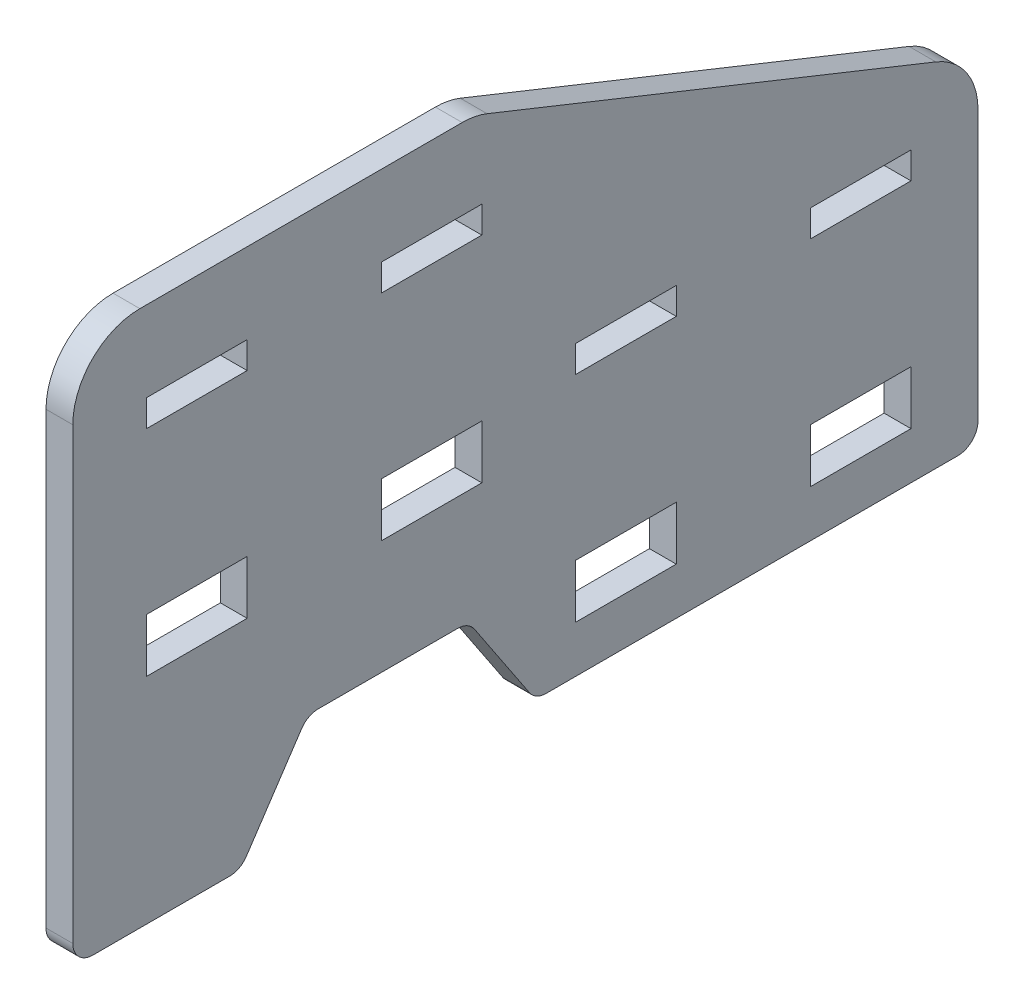
from build123d import *

# Parameters (mm, degrees)
GRUNDFORM_DEPTH          = 4
SKIZZE2_W                = 15
SKIZZE2_H                = 4
ZAPFENDURCHBRUCH_DEPTH   = 157.974520225
VERRUNDUNG1_R            = 10
VERRUNDUNG2_R            = 3
SKIZZE3_W                = 15
SKIZZE3_H                = 4
ZAPFENDURCHBRUCH_2_DEPTH = 4


with BuildPart() as part:
    # Skizze1 → Grundform (new body)
    with BuildSketch(Plane(origin=(0, 0, 0), x_dir=(0, 0, -1), z_dir=(1, 0, 0))):
        Polygon((0, 0), (25, 0), (35, 15), (59, 15), (69, 0), (135, 0), (135, 50), (60, 80), (0, 80), align=None)
    extrude(amount=GRUNDFORM_DEPTH)

    # Skizze2 → Zapfendurchbruch (cut, through all)
    with BuildSketch(Plane(origin=(4, 0, 0), x_dir=(0, 0, -1), z_dir=(1, 0, 0))):
        with Locations((82.5, 41)):
            Rectangle(SKIZZE2_W, SKIZZE2_H)
        with Locations((117.5, 41)):
            Rectangle(SKIZZE2_W, SKIZZE2_H)
        with Locations((117.5, 9)):
            Rectangle(SKIZZE2_W, SKIZZE2_H)
        with Locations((82.5, 9)):
            Rectangle(SKIZZE2_W, SKIZZE2_H)
        with Locations((53.5, 66)):
            Rectangle(SKIZZE2_W, SKIZZE2_H)
        with Locations((18.5, 66)):
            Rectangle(SKIZZE2_W, SKIZZE2_H)
        with Locations((18.5, 34)):
            Rectangle(SKIZZE2_W, SKIZZE2_H)
        with Locations((53.5, 34)):
            Rectangle(SKIZZE2_W, SKIZZE2_H)
    extrude(amount=-ZAPFENDURCHBRUCH_DEPTH, mode=Mode.SUBTRACT)

    # Verrundung1
    verrundung1_edges = [part.edges().sort_by_distance(p)[0] for p in [
        (2, 80, 0),
        (2, 80, -60),
        (2, 50, -135),
    ]]
    fillet(verrundung1_edges, radius=VERRUNDUNG1_R)

    # Verrundung2
    verrundung2_edges = [part.edges().sort_by_distance(p)[0] for p in [
        (2, 0, 0),
        (2, 0, -25),
        (2, 15, -35),
        (2, 15, -59),
        (2, 0, -69),
        (2, 0, -135),
    ]]
    fillet(verrundung2_edges, radius=VERRUNDUNG2_R)

    # Skizze3 → Zapfendurchbruch 2 (cut)
    with BuildSketch(Plane.ZY):
        with Locations((-117.5, 13)):
            Rectangle(SKIZZE3_W, SKIZZE3_H)
        with Locations((-82.5, 13)):
            Rectangle(SKIZZE3_W, SKIZZE3_H)
        with Locations((-53.5, 38)):
            Rectangle(SKIZZE3_W, SKIZZE3_H)
        with Locations((-18.5, 38)):
            Rectangle(SKIZZE3_W, SKIZZE3_H)
    extrude(amount=-ZAPFENDURCHBRUCH_2_DEPTH, mode=Mode.SUBTRACT)


solid = part.part
